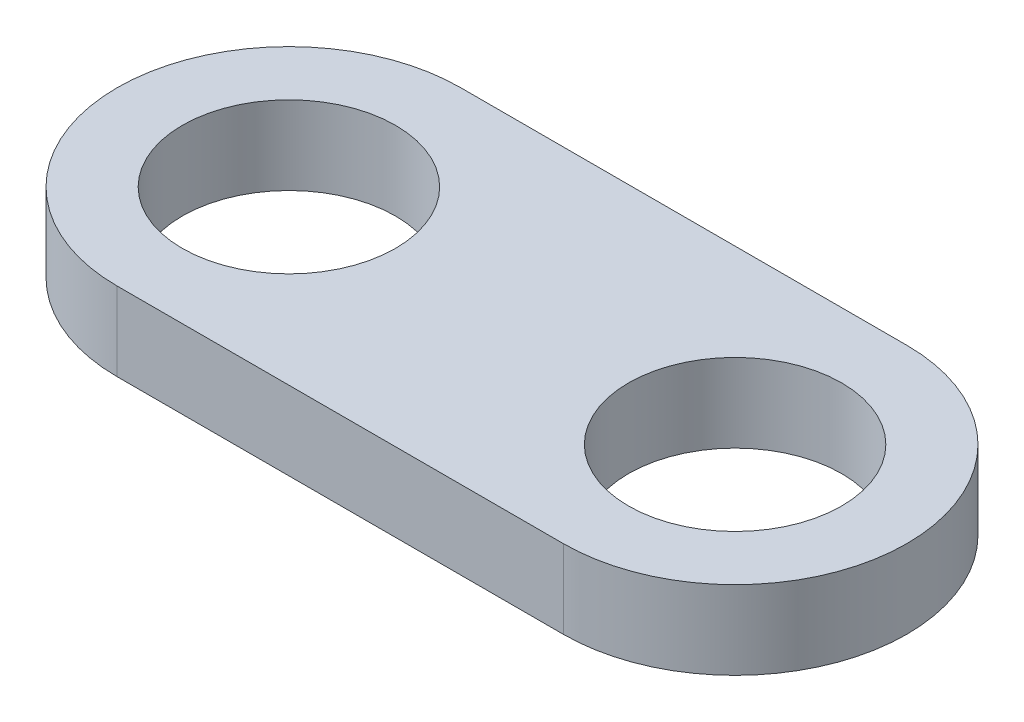
from build123d import *

# Parameters (mm, degrees)
BOSS_EXTRUDE1_DEPTH = 7
SKETCH2_R           = 9.5
CUT_EXTRUDE1_DEPTH  = 48.158841599


with BuildPart() as part:
    # Sketch1 → Boss-Extrude1 (new body)
    with BuildSketch(Plane(origin=(0, 0, 0), x_dir=(1, 0, 0), z_dir=(0, 1, 0))):
        with BuildLine():
            Line((19.879152095, 0), (-19.879152095, 0))
            ThreePointArc((-19.879152095, 0), (-35.184461635, -15.30530954), (-19.879152095, -30.61061908))
            Line((-19.879152095, -30.61061908), (19.879152095, -30.61061908))
            ThreePointArc((19.879152095, -30.61061908), (35.184461635, -15.30530954), (19.879152095, 0))
        make_face()
    extrude(amount=BOSS_EXTRUDE1_DEPTH)

    # Sketch2 → Cut-Extrude1 (cut, through all)
    with BuildSketch(Plane(origin=(0, 7, 0), x_dir=(1, 0, 0), z_dir=(0, 1, 0))):
        with Locations((-19.879152095, -15.30530954)):
            Circle(SKETCH2_R)
        with Locations((19.879152095, -15.30530954)):
            Circle(SKETCH2_R)
    extrude(amount=-CUT_EXTRUDE1_DEPTH, mode=Mode.SUBTRACT)


solid = part.part
